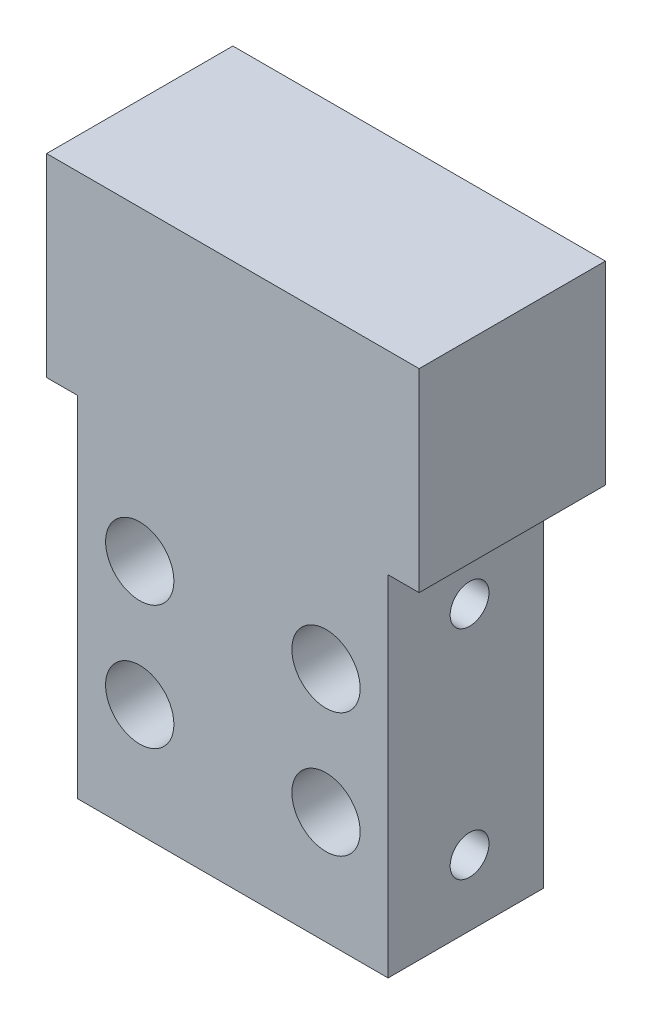
from build123d import *

# Parameters (mm, degrees)
SKETCH1_W                      = 20
SKETCH1_H                      = 22.5
BOSS_EXTRUDE1_DEPTH            = 10
CBORE_FOR_M2_SHCS1_D           = 2.4
CBORE_FOR_M2_SHCS1_CBORE_D     = 4.4
CBORE_FOR_M2_SHCS1_CBORE_DEPTH = 7
SKETCH4_W                      = 24
SKETCH4_H                      = 12
BOSS_EXTRUDE2_DEPTH            = 12.5
TAP_DRILL_FOR_M3X0_5_TAP1_D    = 2.5


with BuildPart() as part:
    # Sketch1 → Boss-Extrude1 (new body)
    with BuildSketch(Plane.XY):
        with Locations((10, 11.25)):
            Rectangle(SKETCH1_W, SKETCH1_H)
    extrude(amount=BOSS_EXTRUDE1_DEPTH)

    # CBORE for M2 SHCS1 (through all)
    with Locations(Plane.XY.offset(10)):
        with Locations((4, 15.25), (16, 15.25), (16, 7.25), (4, 7.25)):
            CounterBoreHole(CBORE_FOR_M2_SHCS1_D / 2, CBORE_FOR_M2_SHCS1_CBORE_D / 2, CBORE_FOR_M2_SHCS1_CBORE_DEPTH)

    # Sketch4 → Boss-Extrude2 (add)
    with BuildSketch(Plane(origin=(0, 22.5, 0), x_dir=(1, 0, 0), z_dir=(0, 1, 0))):
        with Locations((10, -4)):
            Rectangle(SKETCH4_W, SKETCH4_H)
    extrude(amount=BOSS_EXTRUDE2_DEPTH)

    # Tap Drill for M3x0.5 Tap1 (through all)
    with Locations(Plane(origin=(20, 0, 0), x_dir=(0, 0, -1), z_dir=(1, 0, 0))):
        with Locations((-4.751843682, 18.25), (-4.751843682, 4.25)):
            Hole(TAP_DRILL_FOR_M3X0_5_TAP1_D / 2)


solid = part.part
